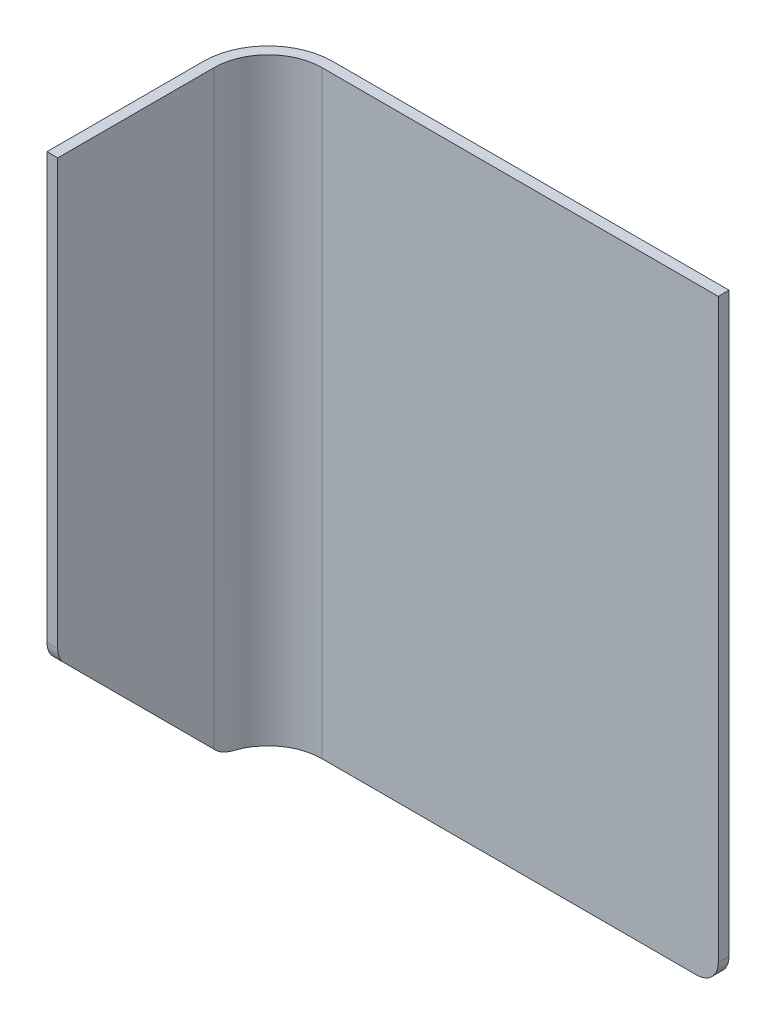
from build123d import *

# Parameters (mm, degrees)
EXTRUDE_1_DEPTH          = 111
CUT_EXTRUDE_1_DEPTH      = 142.665637387
CUT_EXTRUDE_1_DEPTH_BACK = 142.665637387
FILLET_1_R               = 4


with BuildPart() as part:
    # Эскиз1 → Бобышка-Вытянуть1 (new body)
    with BuildSketch(Plane(origin=(0, 0, 0), x_dir=(1, 0, 0), z_dir=(0, 1, 0))):
        with BuildLine():
            Line((43.875245565, 20.926127599), (-29.624754435, 20.926127599))
            ThreePointArc((-29.624754435, 20.926127599), (-38.11003581, 17.411408973), (-41.624754435, 8.926127599))
            Line((-41.624754435, 8.926127599), (-41.624754435, -20.073872401))
            Line((-41.624754435, -20.073872401), (-39.624754435, -20.073872401))
            Line((-39.624754435, -20.073872401), (-39.624754435, 8.926127599))
            ThreePointArc((-39.624754435, 8.926127599), (-36.695822247, 15.997195411), (-29.624754435, 18.926127599))
            Line((-29.624754435, 18.926127599), (43.875245565, 18.926127599))
            Line((43.875245565, 18.926127599), (43.875245565, 20.926127599))
        make_face()
    extrude(amount=-EXTRUDE_1_DEPTH)

    # Эскиз2 → Вырез-Вытянуть1 (cut, two sides: drawn at the far end of the back side and taken through both)
    with BuildSketch(Plane.ZY.offset(41.624754435).offset(-CUT_EXTRUDE_1_DEPTH_BACK)):
        Polygon((-267.586221404, -111), (-20.926127599, -111), (-10.436127599, -111), (20.073872401, -80.49), (20.073872401, 0), (20.073872401, 246.660093805), (404.487683735, -62.517572206), (116.827589929, -420.177666012), align=None)
    extrude(amount=CUT_EXTRUDE_1_DEPTH + CUT_EXTRUDE_1_DEPTH_BACK, mode=Mode.SUBTRACT)

    # Скругление1
    fillet_1_edges = [part.edges().sort_by_distance(p)[0] for p in [
        (-40.519731625, -111, -10.436127599),
        (-40.624754435, -80.49, 20.073872401),
        (43.875245565, -111, -19.926127599),
    ]]
    fillet(fillet_1_edges, radius=FILLET_1_R)


solid = part.part
